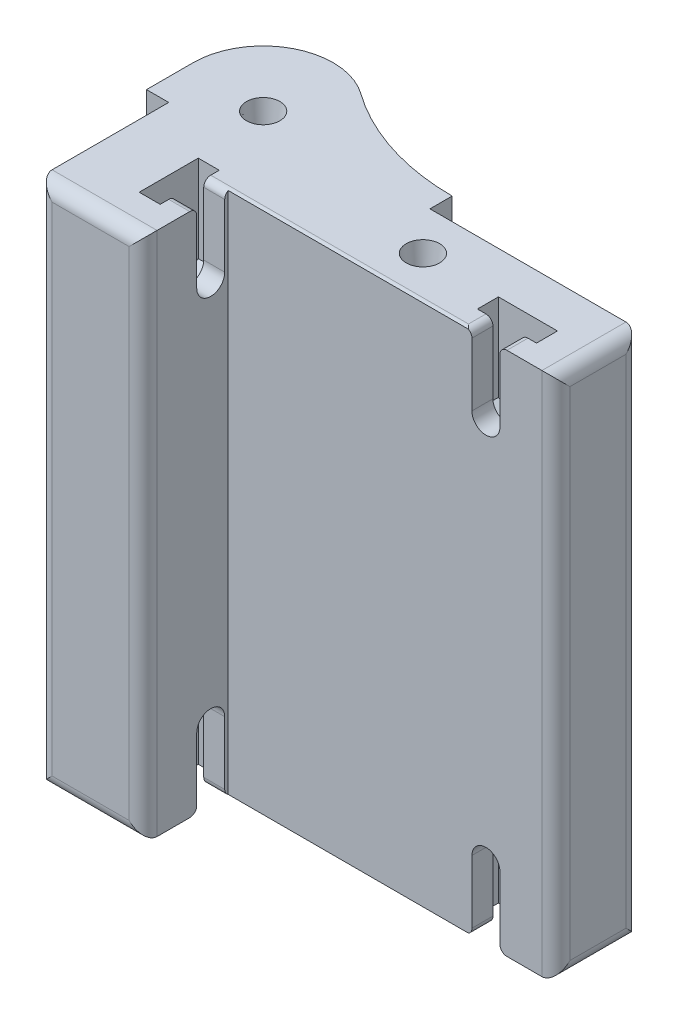
from build123d import *

# Parameters (mm, degrees)
BOSS_EXTRUDE1_DEPTH          = 75
SKETCH2_R                    = 2
CUT_EXTRUDE1_DEPTH           = 15
SKETCH4_R                    = 2
CUT_EXTRUDE2_DEPTH           = 12
SKETCH3_R                    = 2.3876
CUT_EXTRUDE3_DEPTH           = 6.35
CUT_EXTRUDE3_DRAFT           = -8
CUT_EXTRUDE3_PROFILE_2_DEPTH = 6.35
CUT_EXTRUDE3_PROFILE_2_DRAFT = -8
CUT_EXTRUDE4_START           = -3
CUT_EXTRUDE4_DEPTH           = 3
CUT_EXTRUDE5_START           = -3
CUT_EXTRUDE5_DEPTH           = 3
CUT_EXTRUDE6_START           = -3
CUT_EXTRUDE6_DEPTH           = 3
CUT_EXTRUDE7_START           = -3
CUT_EXTRUDE7_DEPTH           = 3
SKETCH9_R                    = 1.4951657
CUT_EXTRUDE8_DEPTH           = 5
MIRROR2_COPY_1_SKETCH_R      = 2.3876
MIRROR2_COPY_1_DEPTH         = 6.35
MIRROR2_COPY_1_DRAFT         = -8
MIRROR2_COPY_2_SKETCH_R      = 2.3876
MIRROR2_COPY_2_DEPTH         = 6.35
MIRROR2_COPY_2_DRAFT         = -8
MIRROR2_COPY_3_SKETCH_R      = 2.3876
MIRROR2_COPY_3_DEPTH         = 6.35
MIRROR2_COPY_3_DRAFT         = -8
FILLET2_START                = 5.175
FILLET2_DEPTH                = 42.1845
FILLET2_START_2              = 10.175
FILLET2_2_DEPTH              = 3.491666667
FILLET2_3_DEPTH              = 37.825
FILLET3_R                    = 2


with BuildPart() as part:
    # Sketch1 → Boss-Extrude1 (new body)
    with BuildSketch(Plane(origin=(0, 0, 0), x_dir=(1, 0, 0), z_dir=(0, 1, 0))):
        with BuildLine():
            Line((-6.825, -6.666666667), (-6.825, -25.333333333))
            Line((-6.825, -25.333333333), (8.175, -25.333333333))
            Line((8.175, -25.333333333), (8.175, -13.175))
            Line((8.175, -13.175), (55, -13.175))
            Line((55, -13.175), (55, -1.175))
            Line((55, -1.175), (25, -1.175))
            Line((25, -1.175), (25, 2))
            ThreePointArc((25, 2), (14.923352523, 3.572976633), (5.805515239, 8.142235123))
            ThreePointArc((5.805515239, 8.142235123), (3.047757271, 9.524241472), (0, 10))
            ThreePointArc((0, 10), (-7.071067812, 7.071067812), (-10, 0))
            Line((-10, 0), (-10, -6.666666667))
            Line((-10, -6.666666667), (-6.825, -6.666666667))
        make_face()
    extrude(amount=BOSS_EXTRUDE1_DEPTH)

    # Sketch2 → Cut-Extrude1 (cut)
    with BuildSketch(Plane.ZY.offset(6.825)):
        with Locations((15.666666667, 65)):
            Circle(SKETCH2_R)
    cut_extrude1 = extrude(amount=-CUT_EXTRUDE1_DEPTH, mode=Mode.SUBTRACT)

    # Sketch4 → Cut-Extrude2 (cut)
    with BuildSketch(Plane(origin=(0, 0, 1.175), x_dir=(-1, 0, 0), z_dir=(0, 0, -1))):
        with Locations((-45, 65)):
            Circle(SKETCH4_R)
    cut_extrude2 = extrude(amount=-CUT_EXTRUDE2_DEPTH, mode=Mode.SUBTRACT)


with BuildPart() as cut_extrude3_tool:
    # Sketch3 → Cut-Extrude3 (with draft: the straight prism first)
    with BuildSketch(Plane(origin=(0, 75, 0), x_dir=(1, 0, 0), z_dir=(0, 1, 0))):
        with Locations((1, -1)):
            Circle(SKETCH3_R)
    extrude(amount=-CUT_EXTRUDE3_DEPTH)
    # Cut-Extrude3: the draft: its side faces are tilted about the plane it starts from
    cut_extrude3_sides = [cut_extrude3_tool.faces().sort_by_distance(p)[0] for p in [
        (-1.3876, 71.825, 1),
    ]]
    draft(cut_extrude3_sides, Plane(origin=(0, 75, 0), x_dir=(1, 0, 0), z_dir=(0, 1, 0)), CUT_EXTRUDE3_DRAFT)


with BuildPart() as part_1:
    add(part.part)

    # Cut-Extrude3: cut by cut_extrude3_tool
    add(cut_extrude3_tool.part, mode=Mode.SUBTRACT)


with BuildPart() as cut_extrude3_profile_2_tool:
    # Sketch3 → Cut-Extrude3 profile 2 (with draft: the straight prism first)
    with BuildSketch(Plane(origin=(0, 75, 0), x_dir=(1, 0, 0), z_dir=(0, 1, 0))):
        with Locations((30, -7.175)):
            Circle(SKETCH3_R)
    extrude(amount=-CUT_EXTRUDE3_PROFILE_2_DEPTH)
    # Cut-Extrude3 profile 2: the draft: its side faces are tilted about the plane it starts from
    cut_extrude3_profile_2_sides = [cut_extrude3_profile_2_tool.faces().sort_by_distance(p)[0] for p in [
        (27.6124, 71.825, 7.175),
    ]]
    draft(cut_extrude3_profile_2_sides, Plane(origin=(0, 75, 0), x_dir=(1, 0, 0), z_dir=(0, 1, 0)), CUT_EXTRUDE3_PROFILE_2_DRAFT)


with BuildPart() as part_2:
    add(part_1.part)

    # Cut-Extrude3 profile 2: cut by cut_extrude3_profile_2_tool
    add(cut_extrude3_profile_2_tool.part, mode=Mode.SUBTRACT)

    # Sketch5 → Cut-Extrude4 (cut)
    with BuildSketch(Plane(origin=(8.175, 0, 0), x_dir=(0, 0, -1), z_dir=(1, 0, 0)).offset(CUT_EXTRUDE4_START)):
        Polygon((-19.885416667, 62.564303552), (-15.666666667, 60.128607104), (-11.447916667, 62.564303552), (-11.447916667, 75), (-19.885416667, 75), align=None)
    cut_extrude4 = extrude(amount=-CUT_EXTRUDE4_DEPTH, mode=Mode.SUBTRACT)

    # Sketch6 → Cut-Extrude5 (cut)
    with BuildSketch(Plane(origin=(8.175, 0, 0), x_dir=(0, 0, -1), z_dir=(1, 0, 0)).offset(CUT_EXTRUDE5_START)):
        with BuildLine():
            Line((-13.666666667, 65), (-13.666666667, 75))
            Line((-13.666666667, 75), (-17.666666667, 75))
            Line((-17.666666667, 75), (-17.666666667, 65))
            ThreePointArc((-17.666666667, 65), (-15.666666667, 67), (-13.666666667, 65))
        make_face()
    cut_extrude5 = extrude(amount=CUT_EXTRUDE5_DEPTH, mode=Mode.SUBTRACT)

    # Sketch7 → Cut-Extrude6 (cut)
    with BuildSketch(Plane.XY.offset(13.175).offset(CUT_EXTRUDE6_START)):
        Polygon((40.78125, 62.564303552), (45, 60.128607104), (49.21875, 62.564303552), (49.21875, 75), (40.78125, 75), align=None)
    cut_extrude6 = extrude(amount=-CUT_EXTRUDE6_DEPTH, mode=Mode.SUBTRACT)

    # Sketch8 → Cut-Extrude7 (cut)
    with BuildSketch(Plane.XY.offset(13.175).offset(CUT_EXTRUDE7_START)):
        with BuildLine():
            Line((47, 65), (47, 75))
            Line((47, 75), (43, 75))
            Line((43, 75), (43, 65))
            ThreePointArc((43, 65), (45, 67), (47, 65))
        make_face()
    cut_extrude7 = extrude(amount=CUT_EXTRUDE7_DEPTH, mode=Mode.SUBTRACT)

    # Sketch9 → Cut-Extrude8 (cut)
    with BuildSketch(Plane(origin=(0, 68.65, 0), x_dir=(1, 0, 0), z_dir=(0, 1, 0))):
        with Locations(Location((1, -1, 0), (0, 0, 270))):
            Circle(SKETCH9_R)
        with Locations(Location((30, -7.175, 0), (0, 0, 270))):
            Circle(SKETCH9_R)
    cut_extrude8 = extrude(amount=-CUT_EXTRUDE8_DEPTH, mode=Mode.SUBTRACT)

    # Mirror2: Cut-Extrude1, Cut-Extrude2, Cut-Extrude4, Cut-Extrude5, Cut-Extrude6, Cut-Extrude7, Cut-Extrude8 across plane
    add(cut_extrude1.mirror(Plane.ZX.offset(37.5)), mode=Mode.SUBTRACT)
    add(cut_extrude2.mirror(Plane.ZX.offset(37.5)), mode=Mode.SUBTRACT)
    add(cut_extrude4.mirror(Plane.ZX.offset(37.5)), mode=Mode.SUBTRACT)
    add(cut_extrude5.mirror(Plane.ZX.offset(37.5)), mode=Mode.SUBTRACT)
    add(cut_extrude6.mirror(Plane.ZX.offset(37.5)), mode=Mode.SUBTRACT)
    add(cut_extrude7.mirror(Plane.ZX.offset(37.5)), mode=Mode.SUBTRACT)
    add(cut_extrude8.mirror(Plane.ZX.offset(37.5)), mode=Mode.SUBTRACT)


with BuildPart() as mirror2_copy_1_tool:
    # Mirror2 copy 1 sketch → Mirror2 copy 1 (with draft: the straight prism first)
    with BuildSketch(Plane.XZ):
        with Locations((1, 1)):
            Circle(MIRROR2_COPY_1_SKETCH_R)
    extrude(amount=-MIRROR2_COPY_1_DEPTH)
    # Mirror2 copy 1: the draft: its side faces are tilted about the plane it starts from
    mirror2_copy_1_sides = [mirror2_copy_1_tool.faces().sort_by_distance(p)[0] for p in [
        (-1.3876, 3.175, 1),
    ]]
    draft(mirror2_copy_1_sides, Plane.XZ, MIRROR2_COPY_1_DRAFT)


with BuildPart() as part_3:
    add(part_2.part)

    # Mirror2 copy 1: cut by mirror2_copy_1_tool
    add(mirror2_copy_1_tool.part, mode=Mode.SUBTRACT)


with BuildPart() as mirror2_copy_2_tool:
    # Mirror2 copy 2 sketch → Mirror2 copy 2 (with draft: the straight prism first)
    with BuildSketch(Plane.XZ):
        with Locations((30, 7.175)):
            Circle(MIRROR2_COPY_2_SKETCH_R)
    extrude(amount=-MIRROR2_COPY_2_DEPTH)
    # Mirror2 copy 2: the draft: its side faces are tilted about the plane it starts from
    mirror2_copy_2_sides = [mirror2_copy_2_tool.faces().sort_by_distance(p)[0] for p in [
        (27.6124, 3.175, 7.175),
    ]]
    draft(mirror2_copy_2_sides, Plane.XZ, MIRROR2_COPY_2_DRAFT)


with BuildPart() as part_4:
    add(part_3.part)

    # Mirror2 copy 2: cut by mirror2_copy_2_tool
    add(mirror2_copy_2_tool.part, mode=Mode.SUBTRACT)


with BuildPart() as mirror2_copy_3_tool:
    # Mirror2 copy 3 sketch → Mirror2 copy 3 (with draft: the straight prism first)
    with BuildSketch(Plane.XZ):
        with Locations((30, 7.175)):
            Circle(MIRROR2_COPY_3_SKETCH_R)
    extrude(amount=-MIRROR2_COPY_3_DEPTH)
    # Mirror2 copy 3: the draft: its side faces are tilted about the plane it starts from
    mirror2_copy_3_sides = [mirror2_copy_3_tool.faces().sort_by_distance(p)[0] for p in [
        (27.6124, 3.175, 7.175),
    ]]
    draft(mirror2_copy_3_sides, Plane.XZ, MIRROR2_COPY_3_DRAFT)


with BuildPart() as part_5:
    add(part_4.part)

    # Mirror2 copy 3: cut by mirror2_copy_3_tool
    add(mirror2_copy_3_tool.part, mode=Mode.SUBTRACT)

    # Fillet2: read off the stored shape, not the designer's step
    # Fillet2 outline → Fillet2 (cut)
    with BuildSketch(Plane.YZ.offset(FILLET2_START)):
        with BuildLine():
            Line((1, 13.666666667), (0, 13.666666667))
            Line((0, 13.666666667), (0, 12.666666667))
            ThreePointArc((0, 12.666666667), (0.292893219, 13.373773448), (1, 13.666666667))
        make_face()
        with BuildLine():
            ThreePointArc((1, 17.666666667), (0.292893218, 17.959559886), (0, 18.666666667))
            Line((0, 18.666666667), (0, 17.666666667))
            Line((0, 17.666666667), (1, 17.666666667))
        make_face()
    extrude(amount=FILLET2_DEPTH, mode=Mode.SUBTRACT)

    # Fillet2 2 outline → Fillet2 2 (cut)
    with BuildSketch(Plane.XY.offset(FILLET2_START_2)):
        with BuildLine():
            Line((47, 1), (47, 0))
            Line((47, 0), (47.3595, 0))
            Line((47.3595, 0), (48, 0))
            ThreePointArc((48, 0), (47.292893219, 0.292893219), (47, 1))
        make_face()
        with BuildLine():
            Line((48, 75), (47, 75))
            Line((47, 75), (47, 74))
            ThreePointArc((47, 74), (47.292893219, 74.707106781), (48, 75))
        make_face()
        with BuildLine():
            Line((43, 75), (42, 75))
            ThreePointArc((42, 75), (42.707106781, 74.707106781), (43, 74))
            Line((43, 74), (43, 75))
        make_face()
        with BuildLine():
            ThreePointArc((43, 1), (42.707106781, 0.292893219), (42, 0))
            Line((42, 0), (43, 0))
            Line((43, 0), (43, 1))
        make_face()
    extrude(amount=FILLET2_2_DEPTH, mode=Mode.SUBTRACT)

    # Fillet2 3 outline → Fillet2 3 (cut)
    with BuildSketch(Plane.YZ.offset(FILLET2_START)):
        with BuildLine():
            Line((74, 17.666666667), (75, 17.666666667))
            Line((75, 17.666666667), (75, 18.666666667))
            ThreePointArc((75, 18.666666667), (74.707106782, 17.959559886), (74, 17.666666667))
        make_face()
        with BuildLine():
            Line((75, 12.666666667), (75, 13.666666667))
            Line((75, 13.666666667), (74, 13.666666667))
            ThreePointArc((74, 13.666666667), (74.707106781, 13.373773448), (75, 12.666666667))
        make_face()
    extrude(amount=FILLET2_3_DEPTH, mode=Mode.SUBTRACT)

    # Fillet3
    fillet3_edges = [part_5.edges().sort_by_distance(p)[0] for p in [
        (55, 0, 7.175),
        (0.675, 0, 25.333333333),
        (55, 37.5, 1.175),
        (55, 37.5, 13.175),
        (8.175, 37.5, 25.333333333),
        (-6.825, 37.5, 25.333333333),
        (0.675, 75, 25.333333333),
        (55, 75, 7.175),
    ]]
    fillet(fillet3_edges, radius=FILLET3_R)


solid = part_5.part
